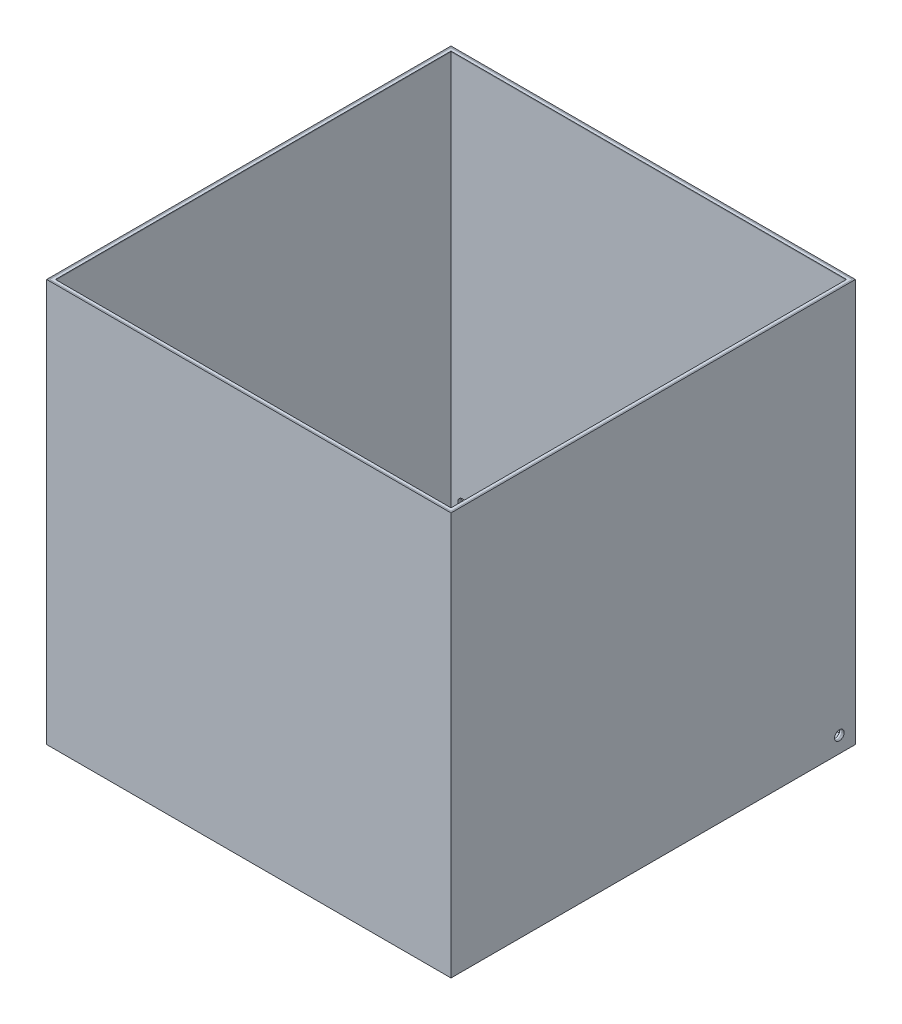
from build123d import *

# Parameters (mm, degrees)
SKETCH1_W              = 1000
SKETCH1_H              = 1000
BOSS_EXTRUDE1_DEPTH    = 1000
SKETCH2_W              = 990
SKETCH2_H              = 990
CUT_EXTRUDE1_DEPTH     = 990
PRIMER_START           = -2
PRIMER_1_OUTLINE_W     = 1004
PRIMER_1_OUTLINE_H     = 1004
PRIMER_1_OUTLINE_W_2   = 1000
PRIMER_1_OUTLINE_H_2   = 1000
PRIMER_1_DEPTH         = 1004
PRIMER_1_2_OUTLINE_W   = 1000
PRIMER_1_2_OUTLINE_H   = 1000
PRIMER_1_2_DEPTH       = 2
PRIMER_START_2         = 1000
PRIMER_1_3_OUTLINE_W   = 1000
PRIMER_1_3_OUTLINE_H   = 1000
PRIMER_1_3_OUTLINE_W_2 = 990
PRIMER_1_3_OUTLINE_H_2 = 990
PRIMER_1_3_DEPTH       = 2
PRIMER_START_3         = -504
PRIMER_2_DEPTH         = 1008
PRIMER_2_2_OUTLINE_W   = 1004
PRIMER_2_2_OUTLINE_H   = 1004
PRIMER_2_2_DEPTH       = 2
PRIMER_START_4         = 502
PRIMER_2_3_OUTLINE_W   = 1004
PRIMER_2_3_OUTLINE_H   = 1004
PRIMER_2_3_DEPTH       = 2
PAINT_START            = -5
PAINT_1_OUTLINE_W      = 1010
PAINT_1_OUTLINE_H      = 1010
PAINT_1_OUTLINE_W_2    = 1008
PAINT_1_OUTLINE_H_2    = 1008
PAINT_1_DEPTH          = 1007
PAINT_1_2_OUTLINE_W    = 1008
PAINT_1_2_OUTLINE_H    = 1008
PAINT_1_2_DEPTH        = 1
PAINT_START_2          = -506
PAINT_2_DEPTH          = 1012
PAINT_2_2_OUTLINE_W    = 1007
PAINT_2_2_OUTLINE_H    = 1010
PAINT_2_2_DEPTH        = 1
PAINT_START_3          = 505
PAINT_2_3_OUTLINE_W    = 1007
PAINT_2_3_OUTLINE_H    = 1010
PAINT_2_3_DEPTH        = 1
SKETCH3_R              = 12
CUT_EXTRUDE2_DEPTH     = 40
SKETCH4_R              = 12
CUT_EXTRUDE3_DEPTH     = 40
SKETCH5_R              = 12
CUT_EXTRUDE4_DEPTH     = 40


# Read off the part's stored shape, not the designer's step: Primer 1, Primer 2, Paint 1, Paint 2
with BuildPart() as part:
    # Sketch1 → Boss-Extrude1 (new body)
    with BuildSketch(Plane(origin=(0, 0, 0), x_dir=(1, 0, 0), z_dir=(0, 1, 0))):
        Rectangle(SKETCH1_W, SKETCH1_H)
    extrude(amount=BOSS_EXTRUDE1_DEPTH)

    # Sketch2 → Cut-Extrude1 (cut)
    with BuildSketch(Plane(origin=(0, 1000, 0), x_dir=(1, 0, 0), z_dir=(0, 1, 0))):
        Rectangle(SKETCH2_W, SKETCH2_H)
    extrude(amount=-CUT_EXTRUDE1_DEPTH, mode=Mode.SUBTRACT)


with BuildPart() as body_2:
    # Primer 1 outline → Primer 1 (new body)
    with BuildSketch(Plane(origin=(0, 0, 0), x_dir=(1, 0, 0), z_dir=(0, 1, 0)).offset(PRIMER_START)):
        Rectangle(PRIMER_1_OUTLINE_W, PRIMER_1_OUTLINE_H)
        Rectangle(PRIMER_1_OUTLINE_W_2, PRIMER_1_OUTLINE_H_2, mode=Mode.SUBTRACT)
    extrude(amount=PRIMER_1_DEPTH)

    # Primer 1 2 outline → Primer 1 2 (add)
    with BuildSketch(Plane(origin=(0, 0, 0), x_dir=(1, 0, 0), z_dir=(0, 1, 0)).offset(PRIMER_START)):
        Rectangle(PRIMER_1_2_OUTLINE_W, PRIMER_1_2_OUTLINE_H)
    extrude(amount=PRIMER_1_2_DEPTH)

    # Primer 1 3 outline → Primer 1 3 (add)
    with BuildSketch(Plane(origin=(0, 0, 0), x_dir=(1, 0, 0), z_dir=(0, 1, 0)).offset(PRIMER_START_2)):
        Rectangle(PRIMER_1_3_OUTLINE_W, PRIMER_1_3_OUTLINE_H)
        Rectangle(PRIMER_1_3_OUTLINE_W_2, PRIMER_1_3_OUTLINE_H_2, mode=Mode.SUBTRACT)
    extrude(amount=PRIMER_1_3_DEPTH)


with BuildPart() as body_3:
    # Primer 2 outline → Primer 2 (new body)
    with BuildSketch(Plane.XY.offset(PRIMER_START_3)):
        Polygon((-504, -4), (504, -4), (504, 1002), (502, 1002), (502, -2), (-502, -2), (-502, 1002), (-504, 1002), align=None)
    extrude(amount=PRIMER_2_DEPTH)

    # Primer 2 2 outline → Primer 2 2 (add)
    with BuildSketch(Plane.XY.offset(PRIMER_START_3)):
        with Locations((0, 500)):
            Rectangle(PRIMER_2_2_OUTLINE_W, PRIMER_2_2_OUTLINE_H)
    extrude(amount=PRIMER_2_2_DEPTH)

    # Primer 2 3 outline → Primer 2 3 (add)
    with BuildSketch(Plane.XY.offset(PRIMER_START_4)):
        with Locations((0, 500)):
            Rectangle(PRIMER_2_3_OUTLINE_W, PRIMER_2_3_OUTLINE_H)
    extrude(amount=PRIMER_2_3_DEPTH)


with BuildPart() as body_4:
    # Paint 1 outline → Paint 1 (new body)
    with BuildSketch(Plane(origin=(0, 0, 0), x_dir=(1, 0, 0), z_dir=(0, 1, 0)).offset(PAINT_START)):
        Rectangle(PAINT_1_OUTLINE_W, PAINT_1_OUTLINE_H)
        Rectangle(PAINT_1_OUTLINE_W_2, PAINT_1_OUTLINE_H_2, mode=Mode.SUBTRACT)
    extrude(amount=PAINT_1_DEPTH)

    # Paint 1 2 outline → Paint 1 2 (add)
    with BuildSketch(Plane(origin=(0, 0, 0), x_dir=(1, 0, 0), z_dir=(0, 1, 0)).offset(PAINT_START)):
        Rectangle(PAINT_1_2_OUTLINE_W, PAINT_1_2_OUTLINE_H)
    extrude(amount=PAINT_1_2_DEPTH)


with BuildPart() as body_5:
    # Paint 2 outline → Paint 2 (new body)
    with BuildSketch(Plane.YZ.offset(PAINT_START_2)):
        Polygon((1002, 506), (-6, 506), (-6, -506), (1002, -506), (1002, -505), (-5, -505), (-5, 505), (1002, 505), align=None)
    extrude(amount=PAINT_2_DEPTH)

    # Paint 2 2 outline → Paint 2 2 (add)
    with BuildSketch(Plane.YZ.offset(PAINT_START_2)):
        with Locations((498.5, 0)):
            Rectangle(PAINT_2_2_OUTLINE_W, PAINT_2_2_OUTLINE_H)
    extrude(amount=PAINT_2_2_DEPTH)

    # Paint 2 3 outline → Paint 2 3 (add)
    with BuildSketch(Plane.YZ.offset(PAINT_START_3)):
        with Locations((498.5, 0)):
            Rectangle(PAINT_2_3_OUTLINE_W, PAINT_2_3_OUTLINE_H)
    extrude(amount=PAINT_2_3_DEPTH)


with BuildPart() as cut_extrude2_tool:
    # Sketch3 → Cut-Extrude2 (new, symmetric)
    with BuildSketch(Plane(origin=(506, 0, 0), x_dir=(0, 0, -1), z_dir=(1, 0, 0))):
        with Locations((466, 34)):
            Circle(SKETCH3_R)
    extrude(amount=CUT_EXTRUDE2_DEPTH, both=True)


with BuildPart() as part_1:
    add(part.part)

    # Cut-Extrude2: cut by cut_extrude2_tool
    add(cut_extrude2_tool.part, mode=Mode.SUBTRACT)


with BuildPart() as body_2_1:
    add(body_2.part)

    # Cut-Extrude2: cut by cut_extrude2_tool
    add(cut_extrude2_tool.part, mode=Mode.SUBTRACT)


with BuildPart() as body_3_1:
    add(body_3.part)

    # Cut-Extrude2: cut by cut_extrude2_tool
    add(cut_extrude2_tool.part, mode=Mode.SUBTRACT)


with BuildPart() as body_4_1:
    add(body_4.part)

    # Cut-Extrude2: cut by cut_extrude2_tool
    add(cut_extrude2_tool.part, mode=Mode.SUBTRACT)


with BuildPart() as body_5_1:
    add(body_5.part)

    # Cut-Extrude2: cut by cut_extrude2_tool
    add(cut_extrude2_tool.part, mode=Mode.SUBTRACT)


with BuildPart() as cut_extrude3_tool:
    # Sketch4 → Cut-Extrude3 (new, symmetric)
    with BuildSketch(Plane(origin=(0, 0, -506), x_dir=(-1, 0, 0), z_dir=(0, 0, -1))):
        with Locations((466, 34)):
            Circle(SKETCH4_R)
    extrude(amount=CUT_EXTRUDE3_DEPTH, both=True)


with BuildPart() as part_2:
    add(part_1.part)

    # Cut-Extrude3: cut by cut_extrude3_tool
    add(cut_extrude3_tool.part, mode=Mode.SUBTRACT)


with BuildPart() as body_2_2:
    add(body_2_1.part)

    # Cut-Extrude3: cut by cut_extrude3_tool
    add(cut_extrude3_tool.part, mode=Mode.SUBTRACT)


with BuildPart() as body_3_2:
    add(body_3_1.part)

    # Cut-Extrude3: cut by cut_extrude3_tool
    add(cut_extrude3_tool.part, mode=Mode.SUBTRACT)


with BuildPart() as body_4_2:
    add(body_4_1.part)

    # Cut-Extrude3: cut by cut_extrude3_tool
    add(cut_extrude3_tool.part, mode=Mode.SUBTRACT)


with BuildPart() as body_5_2:
    add(body_5_1.part)

    # Cut-Extrude3: cut by cut_extrude3_tool
    add(cut_extrude3_tool.part, mode=Mode.SUBTRACT)


with BuildPart() as cut_extrude4_tool:
    # Sketch5 → Cut-Extrude4 (new, symmetric)
    with BuildSketch(Plane.ZY.offset(506)):
        with Locations(Location((466, 34, 0), (0, 0, 180))):
            Circle(SKETCH5_R)
    extrude(amount=CUT_EXTRUDE4_DEPTH, both=True)


with BuildPart() as part_3:
    add(part_2.part)

    # Cut-Extrude4: cut by cut_extrude4_tool
    add(cut_extrude4_tool.part, mode=Mode.SUBTRACT)


with BuildPart() as body_2_3:
    add(body_2_2.part)

    # Cut-Extrude4: cut by cut_extrude4_tool
    add(cut_extrude4_tool.part, mode=Mode.SUBTRACT)


with BuildPart() as body_3_3:
    add(body_3_2.part)

    # Cut-Extrude4: cut by cut_extrude4_tool
    add(cut_extrude4_tool.part, mode=Mode.SUBTRACT)


with BuildPart() as body_4_3:
    add(body_4_2.part)

    # Cut-Extrude4: cut by cut_extrude4_tool
    add(cut_extrude4_tool.part, mode=Mode.SUBTRACT)


with BuildPart() as body_5_3:
    add(body_5_2.part)

    # Cut-Extrude4: cut by cut_extrude4_tool
    add(cut_extrude4_tool.part, mode=Mode.SUBTRACT)


solid = Compound([part_3.part, body_2_3.part, body_3_3.part, body_4_3.part, body_5_3.part])
